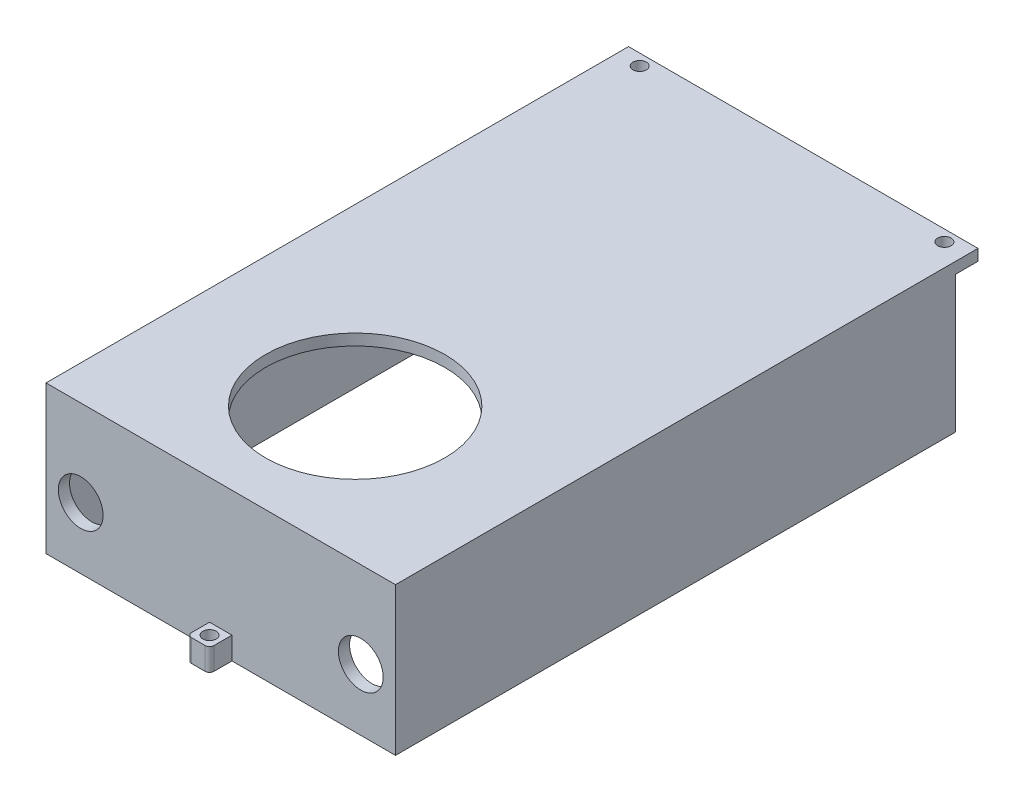
from build123d import *

# Parameters (mm, degrees)
SKETCH1_W           = 156
SKETCH1_H           = 260
BOSS_EXTRUDE1_DEPTH = 5
BOSS_EXTRUDE2_DEPTH = 61
SKETCH3_R           = 40
CUT_EXTRUDE1_DEPTH  = 5
SKETCH4_R           = 10
CUT_EXTRUDE2_DEPTH  = 5
SKETCH5_R           = 3
CUT_EXTRUDE3_DEPTH  = 5
SKETCH6_W           = 10
SKETCH6_H           = 10
BOSS_EXTRUDE3_DEPTH = 10
SKETCH7_R           = 3
CUT_EXTRUDE4_DEPTH  = 10
FILLET1_R           = 2


with BuildPart() as part:
    # Sketch1 → Boss-Extrude1 (new body)
    with BuildSketch(Plane(origin=(0, 0, 0), x_dir=(1, 0, 0), z_dir=(0, 1, 0))):
        Rectangle(SKETCH1_W, SKETCH1_H)
    extrude(amount=BOSS_EXTRUDE1_DEPTH)

    # Sketch2 → Boss-Extrude2 (add)
    with BuildSketch(Plane.XZ):
        Polygon((-73, -120), (-73, 125), (73, 125), (73, -120), (78, -120), (78, 130), (-78, 130), (-78, -120), align=None)
    extrude(amount=BOSS_EXTRUDE2_DEPTH)

    # Sketch3 → Cut-Extrude1 (cut)
    with BuildSketch(Plane(origin=(0, 5, 0), x_dir=(1, 0, 0), z_dir=(0, 1, 0))):
        with Locations((0, -70)):
            Circle(SKETCH3_R)
    extrude(amount=-CUT_EXTRUDE1_DEPTH, mode=Mode.SUBTRACT)

    # Sketch4 → Cut-Extrude2 (cut)
    with BuildSketch(Plane.XY.offset(130)):
        with Locations((-62.5, -33.5)):
            Circle(SKETCH4_R)
        with Locations((62.5, -33.5)):
            Circle(SKETCH4_R)
    extrude(amount=-CUT_EXTRUDE2_DEPTH, mode=Mode.SUBTRACT)

    # Sketch5 → Cut-Extrude3 (cut)
    with BuildSketch(Plane.XZ):
        with Locations((-68, -125)):
            Circle(SKETCH5_R)
        with Locations((68, -125)):
            Circle(SKETCH5_R)
    extrude(amount=-CUT_EXTRUDE3_DEPTH, mode=Mode.SUBTRACT)

    # Sketch6 → Boss-Extrude3 (add)
    with BuildSketch(Plane.XZ.offset(61)):
        with Locations((0, 135)):
            Rectangle(SKETCH6_W, SKETCH6_H)
    extrude(amount=-BOSS_EXTRUDE3_DEPTH)

    # Sketch7 → Cut-Extrude4 (cut)
    with BuildSketch(Plane.XZ.offset(61)):
        with Locations((0, 135)):
            Circle(SKETCH7_R)
    extrude(amount=-CUT_EXTRUDE4_DEPTH, mode=Mode.SUBTRACT)

    # Fillet1
    fillet1_edges = [part.edges().sort_by_distance(p)[0] for p in [
        (5, -56, 140),
        (-5, -56, 140),
    ]]
    fillet(fillet1_edges, radius=FILLET1_R)


solid = part.part
